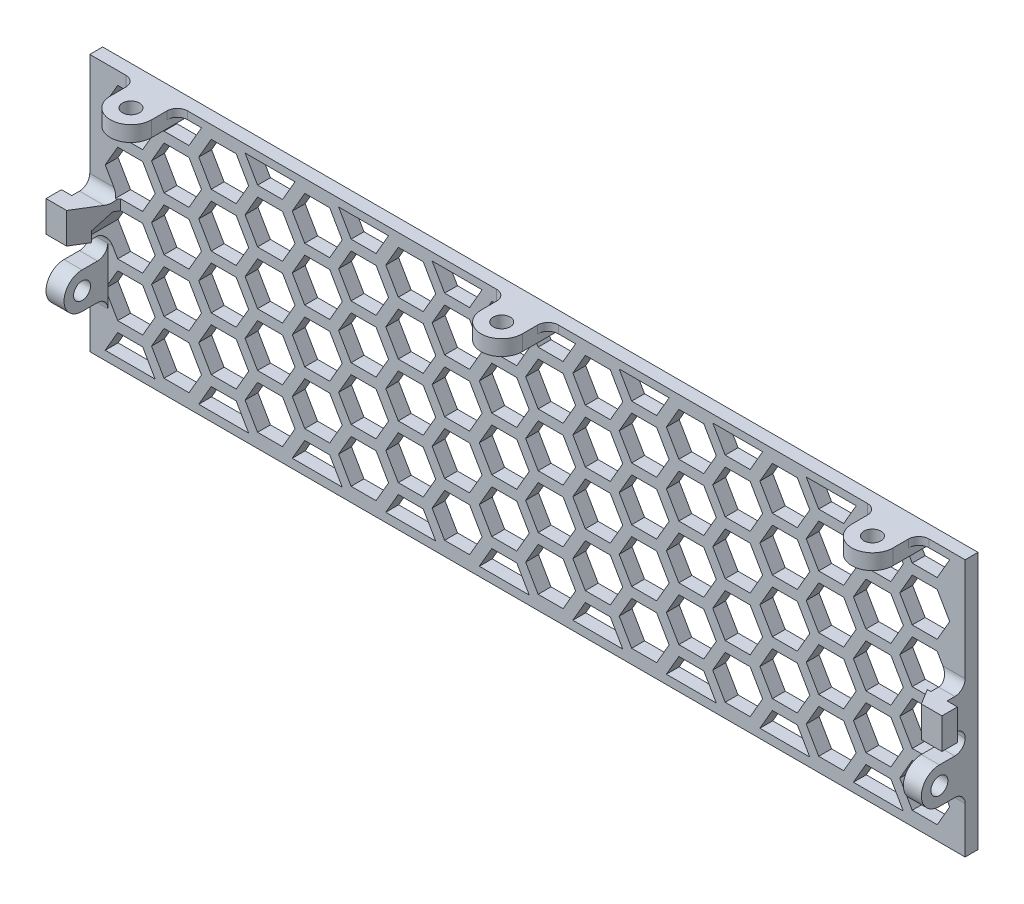
from build123d import *

# Parameters (mm, degrees)
ESBO_O1_W                = 170
ESBO_O1_H                = 50
RESSALTO_EXTRUS_O1_DEPTH = 2.5
RESSALTO_EXTRUS_O2_DEPTH = 3
CORTE_EXTRUS_O1_DEPTH    = 6
ESBO_O4_R                = 1.65
RESSALTO_EXTRUS_O3_DEPTH = 3
RESSALTO_EXTRUS_O4_START = -11
ESBO_O6_W                = 3.5
ESBO_O6_H                = 10
RESSALTO_EXTRUS_O4_DEPTH = 7
ESBO_O7_R                = 1.65
CORTE_EXTRUS_O2_DEPTH    = 175.256276788
FILETE1_R                = 2


with BuildPart() as part:
    # Esboço1 → Ressalto-extrusão1 (new body)
    with BuildSketch(Plane.XY):
        Rectangle(ESBO_O1_W, ESBO_O1_H)
    extrude(amount=RESSALTO_EXTRUS_O1_DEPTH)

    # Esboço2 → Ressalto-extrusão2 (add, symmetric)
    with BuildSketch(Plane(origin=(0, 0, 0), x_dir=(1, 0, 0), z_dir=(0, 1, 0))):
        Polygon((-85, -2.5), (-85, -6), (-87, -6), (-87, -9), (-83, -9), (-79, -2.5), align=None)
        Polygon((85, -2.5), (79, -2.5), (83, -9), (87, -9), (87, -6), (85, -6), align=None)
    extrude(amount=RESSALTO_EXTRUS_O2_DEPTH, both=True)

    # Esboço3 → Corte-extrusão1 (cut)
    with BuildSketch(Plane(origin=(0, 0, 0), x_dir=(-1, 0, 0), z_dir=(0, 0, -1))):
        Polygon((-82, 23.5), (-79.576279931, 19.301993697), (-74.728839794, 19.301993697), (-72.305119725, 23.5), align=None)
        Polygon((-63.305119725, 18.303847577), (-65.728839794, 22.50185388), (-70.576279931, 22.50185388), (-73, 18.303847577), (-70.576279931, 14.105841275), (-65.728839794, 14.105841275), align=None)
        Polygon((63.305119725, 23.5), (73, 23.5), (70.576279931, 19.301993697), (65.728839794, 19.301993697), align=None)
        Polygon((-63.836860034, 23.5), (-61.413139966, 19.301993697), (-56.565699828, 19.301993697), (-54.141979759, 23.5), align=None)
        Polygon((-45.141979759, 18.303847577), (-47.565699828, 22.50185388), (-52.413139966, 22.50185388), (-54.836860034, 18.303847577), (-52.413139966, 14.105841275), (-47.565699828, 14.105841275), align=None)
        Polygon((-45.673720069, 23.5), (-43.25, 19.301993697), (-38.402559862, 19.301993697), (-35.978839794, 23.5), align=None)
        Polygon((-26.978839794, 18.303847577), (-29.402559862, 22.50185388), (-34.25, 22.50185388), (-36.673720069, 18.303847577), (-34.25, 14.105841275), (-29.402559862, 14.105841275), align=None)
        Polygon((-27.510580103, 23.5), (-25.086860034, 19.301993697), (-20.239419897, 19.301993697), (-17.815699828, 23.5), align=None)
        Polygon((-8.815699828, 18.303847577), (-11.239419897, 22.50185388), (-16.086860034, 22.50185388), (-18.510580103, 18.303847577), (-16.086860034, 14.105841275), (-11.239419897, 14.105841275), align=None)
        Polygon((-9.347440138, 23.5), (-6.923720069, 19.301993697), (-2.076279931, 19.301993697), (0.347440138, 23.5), align=None)
        Polygon((9.347440138, 18.303847577), (6.923720069, 22.50185388), (2.076279931, 22.50185388), (-0.347440138, 18.303847577), (2.076279931, 14.105841275), (6.923720069, 14.105841275), align=None)
        Polygon((8.815699828, 23.5), (11.239419897, 19.301993697), (16.086860034, 19.301993697), (18.510580103, 23.5), align=None)
        Polygon((27.510580103, 18.303847577), (25.086860034, 22.50185388), (20.239419897, 22.50185388), (17.815699828, 18.303847577), (20.239419897, 14.105841275), (25.086860034, 14.105841275), align=None)
        Polygon((26.978839794, 23.5), (29.402559862, 19.301993697), (34.25, 19.301993697), (36.673720069, 23.5), align=None)
        Polygon((45.673720069, 18.303847577), (43.25, 22.50185388), (38.402559862, 22.50185388), (35.978839794, 18.303847577), (38.402559862, 14.105841275), (43.25, 14.105841275), align=None)
        Polygon((45.141979759, 23.5), (47.565699828, 19.301993697), (52.413139966, 19.301993697), (54.836860034, 23.5), align=None)
        Polygon((63.836860034, 18.303847577), (61.413139966, 22.50185388), (56.565699828, 22.50185388), (54.141979759, 18.303847577), (56.565699828, 14.105841275), (61.413139966, 14.105841275), align=None)
        Polygon((82, 18.303847577), (79.576279931, 22.50185388), (74.728839794, 22.50185388), (72.305119725, 18.303847577), (74.728839794, 14.105841275), (79.576279931, 14.105841275), align=None)
        Polygon((-54.141979759, 13.107695155), (-56.565699828, 17.305701457), (-61.413139966, 17.305701457), (-63.836860034, 13.107695155), (-61.413139966, 8.909688852), (-56.565699828, 8.909688852), align=None)
        Polygon((-45.141979759, 7.911542732), (-47.565699828, 12.109549034), (-52.413139966, 12.109549034), (-54.836860034, 7.911542732), (-52.413139966, 3.713536429), (-47.565699828, 3.713536429), align=None)
        Polygon((-35.978839794, 13.107695155), (-38.402559862, 17.305701457), (-43.25, 17.305701457), (-45.673720069, 13.107695155), (-43.25, 8.909688852), (-38.402559862, 8.909688852), align=None)
        Polygon((-26.978839794, 7.911542732), (-29.402559862, 12.109549034), (-34.25, 12.109549034), (-36.673720069, 7.911542732), (-34.25, 3.713536429), (-29.402559862, 3.713536429), align=None)
        Polygon((-17.815699828, 13.107695155), (-20.239419897, 17.305701457), (-25.086860034, 17.305701457), (-27.510580103, 13.107695155), (-25.086860034, 8.909688852), (-20.239419897, 8.909688852), align=None)
        Polygon((-8.815699828, 7.911542732), (-11.239419897, 12.109549034), (-16.086860034, 12.109549034), (-18.510580103, 7.911542732), (-16.086860034, 3.713536429), (-11.239419897, 3.713536429), align=None)
        Polygon((0.347440138, 13.107695155), (-2.076279931, 17.305701457), (-6.923720069, 17.305701457), (-9.347440138, 13.107695155), (-6.923720069, 8.909688852), (-2.076279931, 8.909688852), align=None)
        Polygon((9.347440138, 7.911542732), (6.923720069, 12.109549034), (2.076279931, 12.109549034), (-0.347440138, 7.911542732), (2.076279931, 3.713536429), (6.923720069, 3.713536429), align=None)
        Polygon((18.510580103, 13.107695155), (16.086860034, 17.305701457), (11.239419897, 17.305701457), (8.815699828, 13.107695155), (11.239419897, 8.909688852), (16.086860034, 8.909688852), align=None)
        Polygon((27.510580103, 7.911542732), (25.086860034, 12.109549034), (20.239419897, 12.109549034), (17.815699828, 7.911542732), (20.239419897, 3.713536429), (25.086860034, 3.713536429), align=None)
        Polygon((36.673720069, 13.107695155), (34.25, 17.305701457), (29.402559862, 17.305701457), (26.978839794, 13.107695155), (29.402559862, 8.909688852), (34.25, 8.909688852), align=None)
        Polygon((45.673720069, 7.911542732), (43.25, 12.109549034), (38.402559862, 12.109549034), (35.978839794, 7.911542732), (38.402559862, 3.713536429), (43.25, 3.713536429), align=None)
        Polygon((54.836860034, 13.107695155), (52.413139966, 17.305701457), (47.565699828, 17.305701457), (45.141979759, 13.107695155), (47.565699828, 8.909688852), (52.413139966, 8.909688852), align=None)
        Polygon((63.836860034, 7.911542732), (61.413139966, 12.109549034), (56.565699828, 12.109549034), (54.141979759, 7.911542732), (56.565699828, 3.713536429), (61.413139966, 3.713536429), align=None)
        Polygon((73, 13.107695155), (70.576279931, 17.305701457), (65.728839794, 17.305701457), (63.305119725, 13.107695155), (65.728839794, 8.909688852), (70.576279931, 8.909688852), align=None)
        Polygon((82, 7.911542732), (79.576279931, 12.109549034), (74.728839794, 12.109549034), (72.305119725, 7.911542732), (74.728839794, 3.713536429), (79.576279931, 3.713536429), align=None)
        Polygon((-54.141979759, 2.715390309), (-56.565699828, 6.913396612), (-61.413139966, 6.913396612), (-63.836860034, 2.715390309), (-61.413139966, -1.482615993), (-56.565699828, -1.482615993), align=None)
        Polygon((-45.141979759, -2.480762114), (-47.565699828, 1.717244189), (-52.413139966, 1.717244189), (-54.836860034, -2.480762114), (-52.413139966, -6.678768416), (-47.565699828, -6.678768416), align=None)
        Polygon((-35.978839794, 2.715390309), (-38.402559862, 6.913396612), (-43.25, 6.913396612), (-45.673720069, 2.715390309), (-43.25, -1.482615993), (-38.402559862, -1.482615993), align=None)
        Polygon((-26.978839794, -2.480762114), (-29.402559862, 1.717244189), (-34.25, 1.717244189), (-36.673720069, -2.480762114), (-34.25, -6.678768416), (-29.402559862, -6.678768416), align=None)
        Polygon((-17.815699828, 2.715390309), (-20.239419897, 6.913396612), (-25.086860034, 6.913396612), (-27.510580103, 2.715390309), (-25.086860034, -1.482615993), (-20.239419897, -1.482615993), align=None)
        Polygon((-8.815699828, -2.480762114), (-11.239419897, 1.717244189), (-16.086860034, 1.717244189), (-18.510580103, -2.480762114), (-16.086860034, -6.678768416), (-11.239419897, -6.678768416), align=None)
        Polygon((0.347440138, 2.715390309), (-2.076279931, 6.913396612), (-6.923720069, 6.913396612), (-9.347440138, 2.715390309), (-6.923720069, -1.482615993), (-2.076279931, -1.482615993), align=None)
        Polygon((9.347440138, -2.480762114), (6.923720069, 1.717244189), (2.076279931, 1.717244189), (-0.347440138, -2.480762114), (2.076279931, -6.678768416), (6.923720069, -6.678768416), align=None)
        Polygon((18.510580103, 2.715390309), (16.086860034, 6.913396612), (11.239419897, 6.913396612), (8.815699828, 2.715390309), (11.239419897, -1.482615993), (16.086860034, -1.482615993), align=None)
        Polygon((27.510580103, -2.480762114), (25.086860034, 1.717244189), (20.239419897, 1.717244189), (17.815699828, -2.480762114), (20.239419897, -6.678768416), (25.086860034, -6.678768416), align=None)
        Polygon((36.673720069, 2.715390309), (34.25, 6.913396612), (29.402559862, 6.913396612), (26.978839794, 2.715390309), (29.402559862, -1.482615993), (34.25, -1.482615993), align=None)
        Polygon((45.673720069, -2.480762114), (43.25, 1.717244189), (38.402559862, 1.717244189), (35.978839794, -2.480762114), (38.402559862, -6.678768416), (43.25, -6.678768416), align=None)
        Polygon((54.836860034, 2.715390309), (52.413139966, 6.913396612), (47.565699828, 6.913396612), (45.141979759, 2.715390309), (47.565699828, -1.482615993), (52.413139966, -1.482615993), align=None)
        Polygon((63.836860034, -2.480762114), (61.413139966, 1.717244189), (56.565699828, 1.717244189), (54.141979759, -2.480762114), (56.565699828, -6.678768416), (61.413139966, -6.678768416), align=None)
        Polygon((73, 2.715390309), (70.576279931, 6.913396612), (65.728839794, 6.913396612), (63.305119725, 2.715390309), (65.728839794, -1.482615993), (70.576279931, -1.482615993), align=None)
        Polygon((82, -2.480762114), (79.576279931, 1.717244189), (74.728839794, 1.717244189), (72.305119725, -2.480762114), (74.728839794, -6.678768416), (79.576279931, -6.678768416), align=None)
        Polygon((-54.141979759, -7.676914536), (-56.565699828, -3.478908234), (-61.413139966, -3.478908234), (-63.836860034, -7.676914536), (-61.413139966, -11.874920839), (-56.565699828, -11.874920839), align=None)
        Polygon((-45.141979759, -12.873066959), (-47.565699828, -8.675060656), (-52.413139966, -8.675060656), (-54.836860034, -12.873066959), (-52.413139966, -17.071073261), (-47.565699828, -17.071073261), align=None)
        Polygon((-35.978839794, -7.676914536), (-38.402559862, -3.478908234), (-43.25, -3.478908234), (-45.673720069, -7.676914536), (-43.25, -11.874920839), (-38.402559862, -11.874920839), align=None)
        Polygon((-26.978839794, -12.873066959), (-29.402559862, -8.675060656), (-34.25, -8.675060656), (-36.673720069, -12.873066959), (-34.25, -17.071073261), (-29.402559862, -17.071073261), align=None)
        Polygon((-17.815699828, -7.676914536), (-20.239419897, -3.478908234), (-25.086860034, -3.478908234), (-27.510580103, -7.676914536), (-25.086860034, -11.874920839), (-20.239419897, -11.874920839), align=None)
        Polygon((-8.815699828, -12.873066959), (-11.239419897, -8.675060656), (-16.086860034, -8.675060656), (-18.510580103, -12.873066959), (-16.086860034, -17.071073261), (-11.239419897, -17.071073261), align=None)
        Polygon((0.347440138, -7.676914536), (-2.076279931, -3.478908234), (-6.923720069, -3.478908234), (-9.347440138, -7.676914536), (-6.923720069, -11.874920839), (-2.076279931, -11.874920839), align=None)
        Polygon((9.347440138, -12.873066959), (6.923720069, -8.675060656), (2.076279931, -8.675060656), (-0.347440138, -12.873066959), (2.076279931, -17.071073261), (6.923720069, -17.071073261), align=None)
        Polygon((18.510580103, -7.676914536), (16.086860034, -3.478908234), (11.239419897, -3.478908234), (8.815699828, -7.676914536), (11.239419897, -11.874920839), (16.086860034, -11.874920839), align=None)
        Polygon((27.510580103, -12.873066959), (25.086860034, -8.675060656), (20.239419897, -8.675060656), (17.815699828, -12.873066959), (20.239419897, -17.071073261), (25.086860034, -17.071073261), align=None)
        Polygon((36.673720069, -7.676914536), (34.25, -3.478908234), (29.402559862, -3.478908234), (26.978839794, -7.676914536), (29.402559862, -11.874920839), (34.25, -11.874920839), align=None)
        Polygon((45.673720069, -12.873066959), (43.25, -8.675060656), (38.402559862, -8.675060656), (35.978839794, -12.873066959), (38.402559862, -17.071073261), (43.25, -17.071073261), align=None)
        Polygon((54.836860034, -7.676914536), (52.413139966, -3.478908234), (47.565699828, -3.478908234), (45.141979759, -7.676914536), (47.565699828, -11.874920839), (52.413139966, -11.874920839), align=None)
        Polygon((63.836860034, -12.873066959), (61.413139966, -8.675060656), (56.565699828, -8.675060656), (54.141979759, -12.873066959), (56.565699828, -17.071073261), (61.413139966, -17.071073261), align=None)
        Polygon((73, -7.676914536), (70.576279931, -3.478908234), (65.728839794, -3.478908234), (63.305119725, -7.676914536), (65.728839794, -11.874920839), (70.576279931, -11.874920839), align=None)
        Polygon((82, -12.873066959), (79.576279931, -8.675060656), (74.728839794, -8.675060656), (72.305119725, -12.873066959), (74.728839794, -17.071073261), (79.576279931, -17.071073261), align=None)
        Polygon((-72.305119725, 13.107695155), (-74.728839794, 17.305701457), (-79.576279931, 17.305701457), (-82, 13.107695155), (-79.576279931, 8.909688852), (-74.728839794, 8.909688852), align=None)
        Polygon((-63.305119725, 7.911542732), (-65.728839794, 12.109549034), (-70.576279931, 12.109549034), (-73, 7.911542732), (-70.576279931, 3.713536429), (-65.728839794, 3.713536429), align=None)
        Polygon((-72.305119725, 2.715390309), (-74.728839794, 6.913396612), (-79.576279931, 6.913396612), (-82, 2.715390309), (-79.576279931, -1.482615993), (-74.728839794, -1.482615993), align=None)
        Polygon((-63.305119725, -2.480762114), (-65.728839794, 1.717244189), (-70.576279931, 1.717244189), (-73, -2.480762114), (-70.576279931, -6.678768416), (-65.728839794, -6.678768416), align=None)
        Polygon((-72.305119725, -7.676914536), (-74.728839794, -3.478908234), (-79.576279931, -3.478908234), (-82, -7.676914536), (-79.576279931, -11.874920839), (-74.728839794, -11.874920839), align=None)
        Polygon((-63.305119725, -12.873066959), (-65.728839794, -8.675060656), (-70.576279931, -8.675060656), (-73, -12.873066959), (-70.576279931, -17.071073261), (-65.728839794, -17.071073261), align=None)
        Polygon((-72.305119725, -18.069219382), (-74.728839794, -13.871213079), (-79.576279931, -13.871213079), (-82, -18.069219382), (-79.576279931, -22.267225684), (-74.728839794, -22.267225684), align=None)
        Polygon((-63.305119725, -23.265371804), (-65.728839794, -19.067365502), (-70.576279931, -19.067365502), (-73, -23.265371804), align=None)
        Polygon((-54.141979759, -18.069219382), (-56.565699828, -13.871213079), (-61.413139966, -13.871213079), (-63.836860034, -18.069219382), (-61.413139966, -22.267225684), (-56.565699828, -22.267225684), align=None)
        Polygon((-45.141979759, -23.265371804), (-47.565699828, -19.067365502), (-52.413139966, -19.067365502), (-54.836860034, -23.265371804), align=None)
        Polygon((-35.978839794, -18.069219382), (-38.402559862, -13.871213079), (-43.25, -13.871213079), (-45.673720069, -18.069219382), (-43.25, -22.267225684), (-38.402559862, -22.267225684), align=None)
        Polygon((-26.978839794, -23.265371804), (-29.402559862, -19.067365502), (-34.25, -19.067365502), (-36.673720069, -23.265371804), align=None)
        Polygon((-17.815699828, -18.069219382), (-20.239419897, -13.871213079), (-25.086860034, -13.871213079), (-27.510580103, -18.069219382), (-25.086860034, -22.267225684), (-20.239419897, -22.267225684), align=None)
        Polygon((-8.815699828, -23.265371804), (-11.239419897, -19.067365502), (-16.086860034, -19.067365502), (-18.510580103, -23.265371804), align=None)
        Polygon((0.347440138, -18.069219382), (-2.076279931, -13.871213079), (-6.923720069, -13.871213079), (-9.347440138, -18.069219382), (-6.923720069, -22.267225684), (-2.076279931, -22.267225684), align=None)
        Polygon((9.347440138, -23.265371804), (6.923720069, -19.067365502), (2.076279931, -19.067365502), (-0.347440138, -23.265371804), align=None)
        Polygon((18.510580103, -18.069219382), (16.086860034, -13.871213079), (11.239419897, -13.871213079), (8.815699828, -18.069219382), (11.239419897, -22.267225684), (16.086860034, -22.267225684), align=None)
        Polygon((27.510580103, -23.265371804), (25.086860034, -19.067365502), (20.239419897, -19.067365502), (17.815699828, -23.265371804), align=None)
        Polygon((36.673720069, -18.069219382), (34.25, -13.871213079), (29.402559862, -13.871213079), (26.978839794, -18.069219382), (29.402559862, -22.267225684), (34.25, -22.267225684), align=None)
        Polygon((45.673720069, -23.265371804), (43.25, -19.067365502), (38.402559862, -19.067365502), (35.978839794, -23.265371804), align=None)
        Polygon((54.836860034, -18.069219382), (52.413139966, -13.871213079), (47.565699828, -13.871213079), (45.141979759, -18.069219382), (47.565699828, -22.267225684), (52.413139966, -22.267225684), align=None)
        Polygon((63.836860034, -23.265371804), (61.413139966, -19.067365502), (56.565699828, -19.067365502), (54.141979759, -23.265371804), align=None)
        Polygon((73, -18.069219382), (70.576279931, -13.871213079), (65.728839794, -13.871213079), (63.305119725, -18.069219382), (65.728839794, -22.267225684), (70.576279931, -22.267225684), align=None)
        Polygon((82, -23.265371804), (79.576279931, -19.067365502), (74.728839794, -19.067365502), (72.305119725, -23.265371804), align=None)
    extrude(amount=-CORTE_EXTRUS_O1_DEPTH, mode=Mode.SUBTRACT)

    # Esboço4 → Ressalto-extrusão3 (add)
    # profile 1 of 3: a face of its own
    with BuildSketch(Plane(origin=(0, 25, 0), x_dir=(1, 0, 0), z_dir=(0, 1, 0))):
        with BuildLine():
            Line((-4, -7.5), (-4, 0))
            Line((-4, 0), (4, 0))
            Line((4, 0), (4, -7.5))
            ThreePointArc((4, -7.5), (0, -11.5), (-4, -7.5))
        make_face()
        with Locations(Location((0, -7.5, 0), (0, 0, 270))):
            Circle(ESBO_O4_R, mode=Mode.SUBTRACT)
    # profile 2 of 3: a face of its own
    with BuildSketch(Plane(origin=(0, 25, 0), x_dir=(1, 0, 0), z_dir=(0, 1, 0))):
        with BuildLine():
            Line((-76, -7.5), (-76, 0))
            Line((-76, 0), (-68, 0))
            Line((-68, 0), (-68, -7.5))
            ThreePointArc((-68, -7.5), (-72, -11.5), (-76, -7.5))
        make_face()
        with Locations(Location((-72, -7.5, 0), (0, 0, 270))):
            Circle(ESBO_O4_R, mode=Mode.SUBTRACT)
    # profile 3 of 3: a face of its own
    with BuildSketch(Plane(origin=(0, 25, 0), x_dir=(1, 0, 0), z_dir=(0, 1, 0))):
        with BuildLine():
            Line((68, 0), (68, -7.5))
            ThreePointArc((68, -7.5), (72, -11.5), (76, -7.5))
            Line((76, -7.5), (76, 0))
            Line((76, 0), (68, 0))
        make_face()
        with Locations(Location((72, -7.5, 0), (0, 0, 90))):
            Circle(ESBO_O4_R, mode=Mode.SUBTRACT)
    extrude(amount=-RESSALTO_EXTRUS_O3_DEPTH)

    # Esboço6 → Ressalto-extrusão4 (add)
    with BuildSketch(Plane.XZ.offset(25).offset(RESSALTO_EXTRUS_O4_START)):
        with Locations((-83.25, 7.5)):
            Rectangle(ESBO_O6_W, ESBO_O6_H)
        with Locations((83.25, 7.5)):
            Rectangle(ESBO_O6_W, ESBO_O6_H)
    extrude(amount=-RESSALTO_EXTRUS_O4_DEPTH)

    # Esboço7 → Corte-extrusão2 (cut, through all)
    with BuildSketch(Plane.ZY.offset(85)):
        with Locations((7.5, -10.5)):
            Circle(ESBO_O7_R)
        with BuildLine():
            Line((7.5, -7), (12.5, -7))
            Line((12.5, -7), (12.5, -14))
            Line((12.5, -14), (7.5, -14))
            ThreePointArc((7.5, -14), (11, -10.5), (7.5, -7))
        make_face()
    extrude(amount=-CORTE_EXTRUS_O2_DEPTH, mode=Mode.SUBTRACT)

    # Filete1
    # the kernel refuses this fillet: 2 mm, written as the material it adds along each edge
    with BuildSketch(Plane(origin=(85, -3, 2.5), x_dir=(0, -1, 0), z_dir=(-1, 0, 0))) as filete1_piece_1_section:
        with BuildLine():
            CenterArc((FILETE1_R, FILETE1_R), FILETE1_R, 180, 90)
            Line((0, FILETE1_R), (0, 0))
            Line((0, 0), (FILETE1_R, 0))
        make_face()
    filete1_piece_1 = extrude(amount=11, mode=Mode.PRIVATE)
    filete1_piece_1 = split(filete1_piece_1, bisect_by=Plane(origin=(80.7248366, -5.46826674, 2.5), z_dir=(0.8660254037844384, 0.5000000000000004, 0)), keep=Keep.TOP, mode=Mode.PRIVATE)
    filete1_piece_1 = split(filete1_piece_1, bisect_by=Plane(origin=(80.64806867, -3, 5.178111588), z_dir=(0.8516583167045413, 0, -0.5240974256643389)), keep=Keep.TOP, mode=Mode.PRIVATE)
    add(filete1_piece_1)
    with BuildSketch(Plane(origin=(90, -3, 2.5), x_dir=(0, -1, 0), z_dir=(-1, 0, 0))) as filete1_piece_2_section:
        with BuildLine():
            CenterArc((FILETE1_R, FILETE1_R), FILETE1_R, 180, 90)
            Line((0, FILETE1_R), (0, 0))
            Line((0, 0), (FILETE1_R, 0))
        make_face()
    filete1_piece_2 = extrude(amount=16, mode=Mode.PRIVATE)
    filete1_piece_2 = split(filete1_piece_2, bisect_by=Plane(origin=(90, -3.478908234, 2.5), z_dir=(0, 1, 0)), keep=Keep.TOP, mode=Mode.PRIVATE)
    filete1_piece_2 = split(filete1_piece_2, bisect_by=Plane(origin=(81.9748366, -7.633330249, 2.5), z_dir=(-0.8660254037844384, -0.5000000000000004, 0)), keep=Keep.TOP, mode=Mode.PRIVATE)
    filete1_piece_2 = split(filete1_piece_2, bisect_by=Plane(origin=(82.021459227, -3, 7.409871245), z_dir=(0.8516583167045413, 0, -0.5240974256643389)), keep=Keep.TOP, mode=Mode.PRIVATE)
    add(filete1_piece_2)
    with BuildSketch(Plane(origin=(-76.700217866, -3, 2.5), x_dir=(0, -1, 0), z_dir=(-1, 0, 0))) as filete1_piece_3_section:
        with BuildLine():
            CenterArc((FILETE1_R, FILETE1_R), FILETE1_R, 180, 90)
            Line((0, FILETE1_R), (0, 0))
            Line((0, 0), (FILETE1_R, 0))
        make_face()
    filete1_piece_3 = extrude(amount=8.299782134, mode=Mode.PRIVATE)
    filete1_piece_3 = split(filete1_piece_3, bisect_by=Plane(origin=(-80.450217866, -5.165063509, 2.5), z_dir=(-0.8660254037844413, -0.4999999999999954, 0)), keep=Keep.TOP, mode=Mode.PRIVATE)
    add(filete1_piece_3)
    with BuildSketch(Plane(origin=(-74, 3, 2.5), x_dir=(0, 1, 0), z_dir=(-1, 0, 0))) as filete1_piece_4_section:
        with BuildLine():
            CenterArc((FILETE1_R, -FILETE1_R), FILETE1_R, 90, 90)
            Line((0, -FILETE1_R), (0, 0))
            Line((0, 0), (FILETE1_R, 0))
        make_face()
    filete1_piece_4 = extrude(amount=11, mode=Mode.PRIVATE)
    filete1_piece_4 = split(filete1_piece_4, bisect_by=Plane(origin=(-77.626609442, 3, 0.268240343), z_dir=(-0.851658316704544, 0, -0.5240974256643347)), keep=Keep.TOP, mode=Mode.PRIVATE)
    filete1_piece_4 = split(filete1_piece_4, bisect_by=Plane(origin=(-74, 3.713536429, 2.5), z_dir=(0, -1, 0)), keep=Keep.TOP, mode=Mode.PRIVATE)
    add(filete1_piece_4)
    with BuildSketch(Plane(origin=(-74, 3, 2.5), x_dir=(0, 1, 0), z_dir=(-1, 0, 0))) as filete1_piece_5_section:
        with BuildLine():
            CenterArc((FILETE1_R, -FILETE1_R), FILETE1_R, 90, 90)
            Line((0, -FILETE1_R), (0, 0))
            Line((0, 0), (FILETE1_R, 0))
        make_face()
    filete1_piece_5 = extrude(amount=11, mode=Mode.PRIVATE)
    filete1_piece_5 = split(filete1_piece_5, bisect_by=Plane(origin=(-77.873239611, 0.763784068, 2.5), z_dir=(-0.8660254037844413, -0.4999999999999955, 0)), keep=Keep.TOP, mode=Mode.PRIVATE)
    filete1_piece_5 = split(filete1_piece_5, bisect_by=Plane(origin=(-74, 3.713536429, 2.5), z_dir=(0, 1, 0)), keep=Keep.TOP, mode=Mode.PRIVATE)
    add(filete1_piece_5)
    with BuildSketch(Plane(origin=(85, 3, 2.5), x_dir=(0, 1, 0), z_dir=(-1, 0, 0))) as filete1_piece_6_section:
        with BuildLine():
            CenterArc((FILETE1_R, -FILETE1_R), FILETE1_R, 90, 90)
            Line((0, -FILETE1_R), (0, 0))
            Line((0, 0), (FILETE1_R, 0))
        make_face()
    filete1_piece_6 = extrude(amount=8.164319482, mode=Mode.PRIVATE)
    filete1_piece_6 = split(filete1_piece_6, bisect_by=Plane(origin=(82.626760389, 1.629809472, 2.5), z_dir=(0.8660254037844384, 0.5000000000000007, 0)), keep=Keep.TOP, mode=Mode.PRIVATE)
    add(filete1_piece_6)
    with BuildSketch(Plane(origin=(85, -14, 2.5), x_dir=(0, -1, 0), z_dir=(-1, 0, 0)), Plane(origin=(-85, -7, 2.5), x_dir=(0, 1, 0), z_dir=(1, 0, 0))) as filete1_piece_7:
        with BuildLine():
            CenterArc((FILETE1_R, FILETE1_R), FILETE1_R, 180, 90)
            Line((0, FILETE1_R), (0, 0))
            Line((0, 0), (FILETE1_R, 0))
        make_face()
    extrude(amount=3.5)
    with BuildSketch(Plane(origin=(85, -7, 2.5), x_dir=(0, 1, 0), z_dir=(-1, 0, 0))) as filete1_piece_8_section:
        with BuildLine():
            CenterArc((FILETE1_R, -FILETE1_R), FILETE1_R, 90, 90)
            Line((0, -FILETE1_R), (0, 0))
            Line((0, 0), (FILETE1_R, 0))
        make_face()
    filete1_piece_8 = extrude(amount=8.39081679, mode=Mode.PRIVATE)
    filete1_piece_8 = split(filete1_piece_8, bisect_by=Plane(origin=(82.456887408, -8.46826674, 2.5), z_dir=(0.8660254037844384, 0.5000000000000004, 0)), keep=Keep.TOP, mode=Mode.PRIVATE)
    add(filete1_piece_8)
    with BuildSketch(Plane(origin=(68, 22.50185388, 2.5), x_dir=(-1, 0, 0), z_dir=(0, 1, 0))) as filete1_piece_9:
        with BuildLine():
            CenterArc((FILETE1_R, FILETE1_R), FILETE1_R, 180, 90)
            Line((0, FILETE1_R), (0, 0))
            Line((0, 0), (FILETE1_R, 0))
        make_face()
    extrude(amount=2.49814612)
    with BuildSketch(Plane(origin=(76, 25, 2.5), x_dir=(1, 0, 0), z_dir=(0, -1, 0))) as filete1_piece_10:
        with BuildLine():
            CenterArc((FILETE1_R, FILETE1_R), FILETE1_R, 180, 90)
            Line((0, FILETE1_R), (0, 0))
            Line((0, 0), (FILETE1_R, 0))
        make_face()
    extrude(amount=1.5)
    with BuildSketch(Plane(origin=(4, 23.5, 2.5), x_dir=(1, 0, 0), z_dir=(0, 1, 0)), Plane(origin=(-68, 23.5, 2.5), x_dir=(1, 0, 0), z_dir=(0, 1, 0))) as filete1_piece_11:
        with BuildLine():
            CenterArc((FILETE1_R, -FILETE1_R), FILETE1_R, 90, 90)
            Line((0, -FILETE1_R), (0, 0))
            Line((0, 0), (FILETE1_R, 0))
        make_face()
    extrude(amount=1.5)
    with BuildSketch(Plane(origin=(-85, -14, 2.5), x_dir=(0, -1, 0), z_dir=(1, 0, 0))) as filete1_piece_12:
        with BuildLine():
            CenterArc((FILETE1_R, -FILETE1_R), FILETE1_R, 90, 90)
            Line((0, -FILETE1_R), (0, 0))
            Line((0, 0), (FILETE1_R, 0))
        make_face()
    extrude(amount=3.5)
    with BuildSketch(Plane(origin=(-4, 25, 2.5), x_dir=(-1, 0, 0), z_dir=(0, -1, 0)), Plane(origin=(-76, 25, 2.5), x_dir=(-1, 0, 0), z_dir=(0, -1, 0))) as filete1_piece_13:
        with BuildLine():
            CenterArc((FILETE1_R, -FILETE1_R), FILETE1_R, 90, 90)
            Line((0, -FILETE1_R), (0, 0))
            Line((0, 0), (FILETE1_R, 0))
        make_face()
    extrude(amount=2.49814612)


solid = part.part
